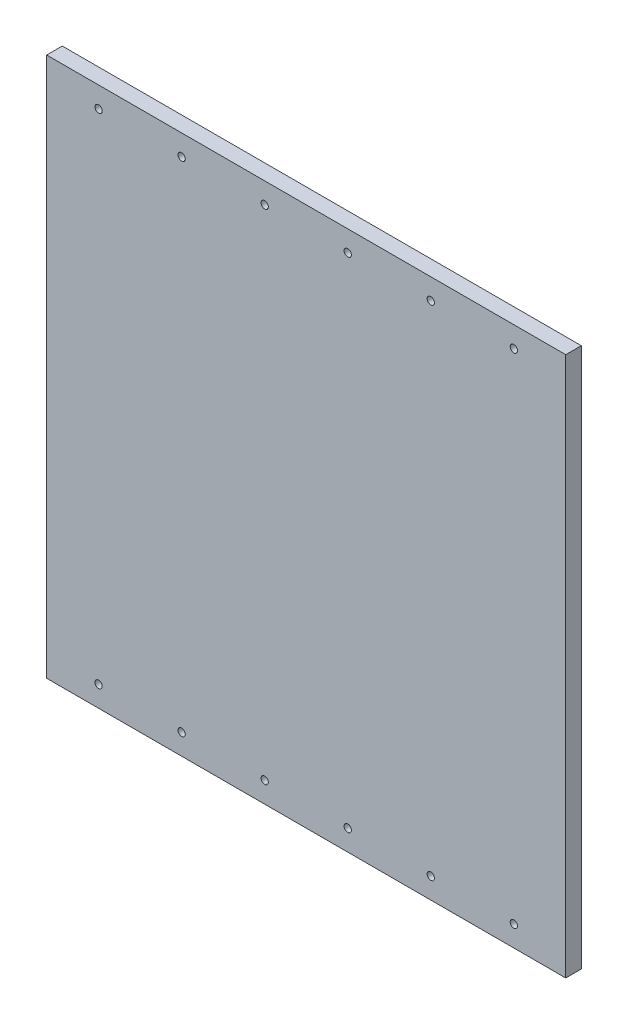
from build123d import *

# Parameters (mm, degrees)
ESQUISSE1_W             = 500
ESQUISSE1_H             = 520
BOSS_EXTRU_1_DEPTH      = 15
ESQUISSE2_R             = 3.5
ENL_V_MAT_EXTRU_1_DEPTH = 722.543484483


with BuildPart() as part:
    # Esquisse1 → Boss.-Extru.1 (new body)
    with BuildSketch(Plane.XY):
        with Locations((250, 260)):
            Rectangle(ESQUISSE1_W, ESQUISSE1_H)
    extrude(amount=BOSS_EXTRU_1_DEPTH)

    # Esquisse2 → Enlèv. mat.-Extru.1 (cut, through all)
    with BuildSketch(Plane.XY.offset(15)):
        with Locations((210, 500)):
            Circle(ESQUISSE2_R)
        with Locations((290, 500)):
            Circle(ESQUISSE2_R)
        with Locations((130, 500)):
            Circle(ESQUISSE2_R)
        with Locations((50, 500)):
            Circle(ESQUISSE2_R)
        with Locations((450, 500)):
            Circle(ESQUISSE2_R)
        with Locations((370, 500)):
            Circle(ESQUISSE2_R)
        with Locations((370, 20)):
            Circle(ESQUISSE2_R)
        with Locations((450, 20)):
            Circle(ESQUISSE2_R)
        with Locations((50, 20)):
            Circle(ESQUISSE2_R)
        with Locations((130, 20)):
            Circle(ESQUISSE2_R)
        with Locations((290, 20)):
            Circle(ESQUISSE2_R)
        with Locations((210, 20)):
            Circle(ESQUISSE2_R)
    extrude(amount=-ENL_V_MAT_EXTRU_1_DEPTH, mode=Mode.SUBTRACT)


solid = part.part
